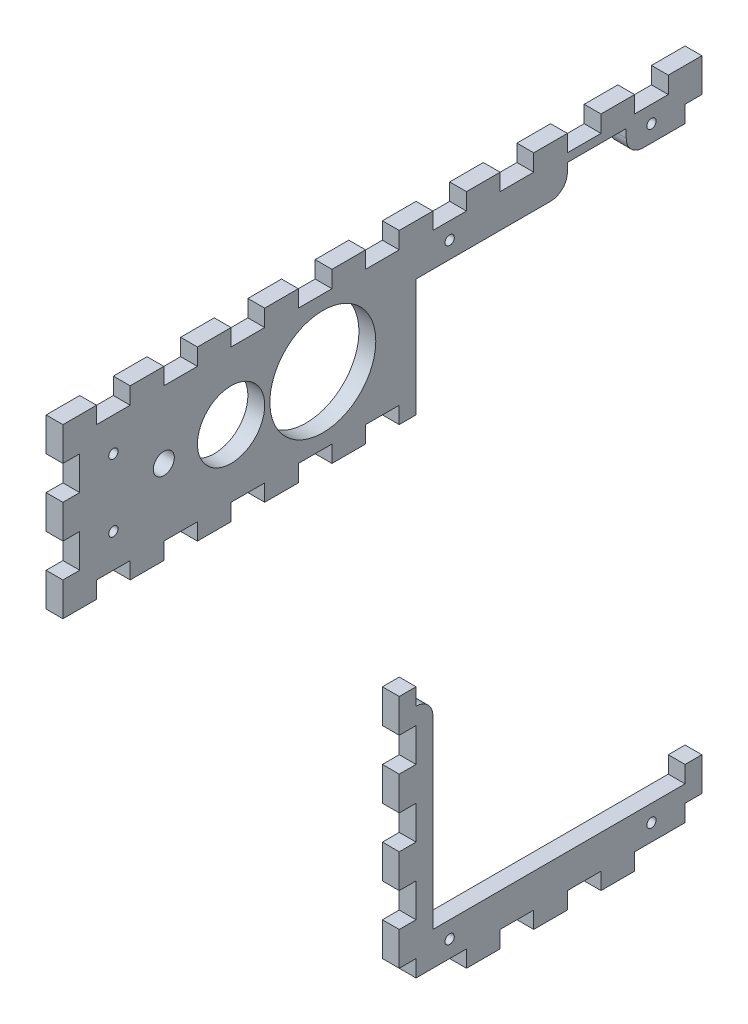
from build123d import *

# Parameters (mm, degrees)
SKETCH1_R           = 1.75
BOSS_EXTRUDE1_DEPTH = 6.35
SKETCH2_W           = 12.7
SKETCH2_H           = 6.35
CUT_EXTRUDE1_DEPTH  = 285.051619429
LPATTERN1_COUNT     = 10
LPATTERN1_PITCH     = 25.4
SKETCH3_W           = 6.35
SKETCH3_H           = 12.7
CUT_EXTRUDE2_DEPTH  = 285.051619429
LPATTERN2_COUNT     = 10
LPATTERN2_PITCH     = 25.4
SKETCH4_W           = 6.35
SKETCH4_H           = 12.7
CUT_EXTRUDE3_DEPTH  = 285.051619429
SKETCH5_W           = 12.7
SKETCH5_H           = 6.35
CUT_EXTRUDE4_DEPTH  = 285.051619429
LPATTERN3_COUNT     = 5
LPATTERN3_PITCH     = 25.4
SKETCH6_W           = 6.35
SKETCH6_H           = 12.7
CUT_EXTRUDE5_DEPTH  = 285.051619429
LPATTERN4_COUNT     = 8
LPATTERN4_PITCH     = 25.4
SKETCH7_W           = 12.7
SKETCH7_H           = 6.35
CUT_EXTRUDE6_DEPTH  = 285.051619429
SKETCH8_W           = 6.35
SKETCH8_H           = 6.35
CUT_EXTRUDE7_DEPTH  = 285.051619429
SKETCH9_W           = 88.9
SKETCH9_H           = 215.9
CUT_EXTRUDE8_DEPTH  = 285.051619429
SKETCH10_R          = 3.96875
CUT_EXTRUDE9_DEPTH  = 285.051619429
SKETCH12_R          = 12.7
CUT_EXTRUDE11_DEPTH = 285.051619429
SKETCH13_R          = 20
CUT_EXTRUDE12_DEPTH = 285.051619429
SKETCH14_W          = 6.35
SKETCH14_H          = 139.7
SKETCH14_W_2        = 22.225
SKETCH14_H_2        = 9.525
SKETCH14_H_3        = 215.9
CUT_EXTRUDE14_DEPTH = 285.051619429
SKETCH15_W          = 6.35
SKETCH15_H          = 101.6
CUT_EXTRUDE15_DEPTH = 285.051619429
FILLET1_R           = 6.35
SKETCH16_W          = 29.62248357
SKETCH16_H          = 194.777974162
SKETCH16_W_2        = 38.14401994
SKETCH16_H_2        = 73.853315203
CUT_EXTRUDE16_DEPTH = 285.051619429
FILLET2_R           = 6.35


with BuildPart() as part:
    # Sketch1 → Boss-Extrude1 (new body)
    with BuildSketch(Plane(origin=(0, 0, 0), x_dir=(0, 0, -1), z_dir=(1, 0, 0))):
        Polygon((0, 0), (0, 190.5), (-127, 190.5), (-127, 254), (114.3, 254), (114.3, 0), align=None)
        with Locations((-107.95, 234.95)):
            Circle(SKETCH1_R, mode=Mode.SUBTRACT)
        with Locations((-107.95, 209.55)):
            Circle(SKETCH1_R, mode=Mode.SUBTRACT)
        with Locations((19.05, 241.3)):
            Circle(SKETCH1_R, mode=Mode.SUBTRACT)
        with Locations((95.25, 241.3)):
            Circle(SKETCH1_R, mode=Mode.SUBTRACT)
        with Locations((19.05, 12.7)):
            Circle(SKETCH1_R, mode=Mode.SUBTRACT)
        with Locations((95.25, 12.7)):
            Circle(SKETCH1_R, mode=Mode.SUBTRACT)
    extrude(amount=BOSS_EXTRUDE1_DEPTH)

    # Sketch2 → Cut-Extrude1 (cut, through all)
    with BuildSketch(Plane(origin=(6.35, 0, 0), x_dir=(0, 0, -1), z_dir=(1, 0, 0))):
        with Locations((-107.95, 250.825)):
            Rectangle(SKETCH2_W, SKETCH2_H)
    cut_extrude1 = extrude(amount=-CUT_EXTRUDE1_DEPTH, mode=Mode.SUBTRACT)

    # LPattern1: Cut-Extrude1 ×10
    with Locations(*[(0, 0, -i * LPATTERN1_PITCH) for i in range(1, LPATTERN1_COUNT)]):
        add(cut_extrude1, mode=Mode.SUBTRACT)

    # Sketch3 → Cut-Extrude2 (cut, through all)
    with BuildSketch(Plane(origin=(6.35, 0, 0), x_dir=(0, 0, -1), z_dir=(1, 0, 0))):
        with Locations((111.125, 234.95)):
            Rectangle(SKETCH3_W, SKETCH3_H)
    cut_extrude2 = extrude(amount=-CUT_EXTRUDE2_DEPTH, mode=Mode.SUBTRACT)

    # LPattern2: Cut-Extrude2 ×10
    with Locations(*[(0, -i * LPATTERN2_PITCH, 0) for i in range(1, LPATTERN2_COUNT)]):
        add(cut_extrude2, mode=Mode.SUBTRACT)

    # Sketch4 → Cut-Extrude3 (cut, through all)
    with BuildSketch(Plane(origin=(6.35, 0, 0), x_dir=(0, 0, -1), z_dir=(1, 0, 0))):
        with Locations((-123.825, 234.95)):
            Rectangle(SKETCH4_W, SKETCH4_H)
        with Locations((-123.825, 209.55)):
            Rectangle(SKETCH4_W, SKETCH4_H)
    extrude(amount=-CUT_EXTRUDE3_DEPTH, mode=Mode.SUBTRACT)

    # Sketch5 → Cut-Extrude4 (cut, through all)
    with BuildSketch(Plane(origin=(6.35, 0, 0), x_dir=(0, 0, -1), z_dir=(1, 0, 0))):
        with Locations((-107.95, 193.675)):
            Rectangle(SKETCH5_W, SKETCH5_H)
    cut_extrude4 = extrude(amount=-CUT_EXTRUDE4_DEPTH, mode=Mode.SUBTRACT)

    # LPattern3: Cut-Extrude4 ×5
    with Locations(*[(0, 0, -i * LPATTERN3_PITCH) for i in range(1, LPATTERN3_COUNT)]):
        add(cut_extrude4, mode=Mode.SUBTRACT)

    # Sketch6 → Cut-Extrude5 (cut, through all)
    with BuildSketch(Plane(origin=(6.35, 0, 0), x_dir=(0, 0, -1), z_dir=(1, 0, 0))):
        with Locations((3.175, 6.35)):
            Rectangle(SKETCH6_W, SKETCH6_H)
    cut_extrude5 = extrude(amount=-CUT_EXTRUDE5_DEPTH, mode=Mode.SUBTRACT)

    # LPattern4: Cut-Extrude5 ×8
    with Locations(*[(0, i * LPATTERN4_PITCH, 0) for i in range(1, LPATTERN4_COUNT)]):
        add(cut_extrude5, mode=Mode.SUBTRACT)

    # Sketch7 → Cut-Extrude6 (cut, through all)
    with BuildSketch(Plane(origin=(6.35, 0, 0), x_dir=(0, 0, -1), z_dir=(1, 0, 0))):
        with Locations((19.05, 3.175)):
            Rectangle(SKETCH7_W, SKETCH7_H)
        with Locations((44.45, 3.175)):
            Rectangle(SKETCH7_W, SKETCH7_H)
        with Locations((69.85, 3.175)):
            Rectangle(SKETCH7_W, SKETCH7_H)
        with Locations((95.25, 3.175)):
            Rectangle(SKETCH7_W, SKETCH7_H)
    extrude(amount=-CUT_EXTRUDE6_DEPTH, mode=Mode.SUBTRACT)

    # Sketch8 → Cut-Extrude7 (cut, through all)
    with BuildSketch(Plane(origin=(6.35, 0, 0), x_dir=(0, 0, -1), z_dir=(1, 0, 0))):
        with Locations((9.525, 3.175)):
            Rectangle(SKETCH8_W, SKETCH8_H)
        with Locations((104.775, 3.175)):
            Rectangle(SKETCH8_W, SKETCH8_H)
    extrude(amount=-CUT_EXTRUDE7_DEPTH, mode=Mode.SUBTRACT)

    # Sketch9 → Cut-Extrude8 (cut, through all)
    with BuildSketch(Plane(origin=(6.35, 0, 0), x_dir=(0, 0, -1), z_dir=(1, 0, 0))):
        with Locations((57.15, 127)):
            Rectangle(SKETCH9_W, SKETCH9_H)
    extrude(amount=-CUT_EXTRUDE8_DEPTH, mode=Mode.SUBTRACT)

    # Sketch10 → Cut-Extrude9 (cut, through all)
    with BuildSketch(Plane(origin=(6.35, 0, 0), x_dir=(0, 0, -1), z_dir=(1, 0, 0))):
        with Locations((-88.9, 222.25)):
            Circle(SKETCH10_R)
    extrude(amount=-CUT_EXTRUDE9_DEPTH, mode=Mode.SUBTRACT)

    # Sketch12 → Cut-Extrude11 (cut, through all)
    with BuildSketch(Plane(origin=(6.35, 0, 0), x_dir=(0, 0, -1), z_dir=(1, 0, 0))):
        with Locations((-63.5, 222.25)):
            Circle(SKETCH12_R)
    extrude(amount=-CUT_EXTRUDE11_DEPTH, mode=Mode.SUBTRACT)

    # Sketch13 → Cut-Extrude12 (cut, through all)
    with BuildSketch(Plane(origin=(6.35, 0, 0), x_dir=(0, 0, -1), z_dir=(1, 0, 0))):
        with Locations((-28.849999958, 222.25)):
            Circle(SKETCH13_R)
    extrude(amount=-CUT_EXTRUDE12_DEPTH, mode=Mode.SUBTRACT)

    # Sketch14 → Cut-Extrude14 (cut, through all)
    with BuildSketch(Plane(origin=(6.35, 0, 0), x_dir=(0, 0, -1), z_dir=(1, 0, 0))):
        with Locations((9.525, 165.1)):
            Rectangle(SKETCH14_W, SKETCH14_H)
        with Locations((74.6125, 239.7125)):
            Rectangle(SKETCH14_W_2, SKETCH14_H_2)
        with Locations((104.775, 127)):
            Rectangle(SKETCH14_W, SKETCH14_H_3)
    extrude(amount=-CUT_EXTRUDE14_DEPTH, mode=Mode.SUBTRACT)


with BuildPart() as cut_extrude14_piece_1:
    # of the separate pieces the step leaves, piece 1, a body of its own (cut_extrude14_pieces)
    add(part.part.solids().sort_by_distance((0, 234.95, -107.95))[0])

    # Fillet1
    fillet1_edges = [cut_extrude14_piece_1.edges().sort_by_distance(p)[0] for p in [
        (3.175, 234.95, -63.5),
        (3.175, 234.95, -85.725),
    ]]
    fillet(fillet1_edges, radius=FILLET1_R)


with BuildPart() as cut_extrude14_piece_2:
    # of the separate pieces the step leaves, piece 2, a body of its own (cut_extrude14_pieces)
    add(part.part.solids().sort_by_distance((6.35, 63.5, 0))[0])

    # Fillet2
    fillet2_edges = [cut_extrude14_piece_2.edges().sort_by_distance(p)[0] for p in [
        (3.175, 95.25, -12.7),
    ]]
    fillet(fillet2_edges, radius=FILLET2_R - 0.0001)  # a hair under: the kernel refuses the full size


with BuildPart() as cut_extrude14_piece_3:
    # of the separate pieces the step leaves, piece 3, a body of its own (cut_extrude14_pieces)
    add(part.part.solids().sort_by_distance((0, 38.1, -107.95))[0])


with BuildPart() as cut_extrude14_piece_4:
    # of the separate pieces the step leaves, piece 4, a body of its own (cut_extrude14_pieces)
    add(part.part.solids().sort_by_distance((0, 139.7, -107.95))[0])


with BuildPart() as cut_extrude14_piece_5:
    # of the separate pieces the step leaves, piece 5, a body of its own (cut_extrude14_pieces)
    add(part.part.solids().sort_by_distance((0, 114.3, -107.95))[0])


with BuildPart() as cut_extrude14_piece_6:
    # of the separate pieces the step leaves, piece 6, a body of its own (cut_extrude14_pieces)
    add(part.part.solids().sort_by_distance((0, 190.5, -107.95))[0])


with BuildPart() as cut_extrude14_piece_7:
    # of the separate pieces the step leaves, piece 7, a body of its own (cut_extrude14_pieces)
    add(part.part.solids().sort_by_distance((0, 215.9, -107.95))[0])


with BuildPart() as cut_extrude14_piece_8:
    # of the separate pieces the step leaves, piece 8, a body of its own (cut_extrude14_pieces)
    add(part.part.solids().sort_by_distance((0, 63.5, -107.95))[0])


with BuildPart() as cut_extrude14_piece_9:
    # of the separate pieces the step leaves, piece 9, a body of its own (cut_extrude14_pieces)
    add(part.part.solids().sort_by_distance((0, 165.1, -107.95))[0])


with BuildPart() as cut_extrude14_piece_10:
    # of the separate pieces the step leaves, piece 10, a body of its own (cut_extrude14_pieces)
    add(part.part.solids().sort_by_distance((0, 88.9, -107.95))[0])


with BuildPart() as cut_extrude14_piece_11:
    # of the separate pieces the step leaves, piece 11, a body of its own (cut_extrude14_pieces)
    add(part.part.solids().sort_by_distance((0, 177.8, -6.35))[0])


with BuildPart() as cut_extrude14_piece_12:
    # of the separate pieces the step leaves, piece 12, a body of its own (cut_extrude14_pieces)
    add(part.part.solids().sort_by_distance((0, 127, -6.35))[0])


with BuildPart() as cut_extrude14_piece_13:
    # of the separate pieces the step leaves, piece 13, a body of its own (cut_extrude14_pieces)
    add(part.part.solids().sort_by_distance((0, 152.4, -6.35))[0])


with BuildPart() as cut_extrude15_tool:
    # Sketch15 → Cut-Extrude15 (new, through all)
    with BuildSketch(Plane(origin=(6.35, 0, 0), x_dir=(0, 0, -1), z_dir=(1, 0, 0))):
        with Locations((111.125, 114.3)):
            Rectangle(SKETCH15_W, SKETCH15_H)
    extrude(amount=-CUT_EXTRUDE15_DEPTH)


with BuildPart() as cut_extrude14_piece_4_1:
    add(cut_extrude14_piece_4.part)

    # Cut-Extrude15: cut by cut_extrude15_tool
    add(cut_extrude15_tool.part, mode=Mode.SUBTRACT)


with BuildPart() as cut_extrude14_piece_5_1:
    add(cut_extrude14_piece_5.part)

    # Cut-Extrude15: cut by cut_extrude15_tool
    add(cut_extrude15_tool.part, mode=Mode.SUBTRACT)


with BuildPart() as cut_extrude14_piece_8_1:
    add(cut_extrude14_piece_8.part)

    # Cut-Extrude15: cut by cut_extrude15_tool
    add(cut_extrude15_tool.part, mode=Mode.SUBTRACT)


with BuildPart() as cut_extrude14_piece_10_1:
    add(cut_extrude14_piece_10.part)

    # Cut-Extrude15: cut by cut_extrude15_tool
    add(cut_extrude15_tool.part, mode=Mode.SUBTRACT)


with BuildPart() as cut_extrude16_tool:
    # Sketch16 → Cut-Extrude16 (new, through all)
    with BuildSketch(Plane(origin=(6.35, 0, 0), x_dir=(0, 0, -1), z_dir=(1, 0, 0))):
        with Locations((111.610650232, 133.672166478)):
            Rectangle(SKETCH16_W, SKETCH16_H)
        with Locations((5.091445612, 147.063152203)):
            Rectangle(SKETCH16_W_2, SKETCH16_H_2)
    extrude(amount=-CUT_EXTRUDE16_DEPTH)


with BuildPart() as cut_extrude14_piece_3_1:
    add(cut_extrude14_piece_3.part)

    # Cut-Extrude16: cut by cut_extrude16_tool
    add(cut_extrude16_tool.part, mode=Mode.SUBTRACT)


with BuildPart() as cut_extrude14_piece_6_1:
    add(cut_extrude14_piece_6.part)

    # Cut-Extrude16: cut by cut_extrude16_tool
    add(cut_extrude16_tool.part, mode=Mode.SUBTRACT)


with BuildPart() as cut_extrude14_piece_7_1:
    add(cut_extrude14_piece_7.part)

    # Cut-Extrude16: cut by cut_extrude16_tool
    add(cut_extrude16_tool.part, mode=Mode.SUBTRACT)


with BuildPart() as cut_extrude14_piece_9_1:
    add(cut_extrude14_piece_9.part)

    # Cut-Extrude16: cut by cut_extrude16_tool
    add(cut_extrude16_tool.part, mode=Mode.SUBTRACT)


with BuildPart() as cut_extrude14_piece_11_1:
    add(cut_extrude14_piece_11.part)

    # Cut-Extrude16: cut by cut_extrude16_tool
    add(cut_extrude16_tool.part, mode=Mode.SUBTRACT)


with BuildPart() as cut_extrude14_piece_12_1:
    add(cut_extrude14_piece_12.part)

    # Cut-Extrude16: cut by cut_extrude16_tool
    add(cut_extrude16_tool.part, mode=Mode.SUBTRACT)


with BuildPart() as cut_extrude14_piece_13_1:
    add(cut_extrude14_piece_13.part)

    # Cut-Extrude16: cut by cut_extrude16_tool
    add(cut_extrude16_tool.part, mode=Mode.SUBTRACT)


solid = Compound([cut_extrude14_piece_1.part, cut_extrude14_piece_2.part])
